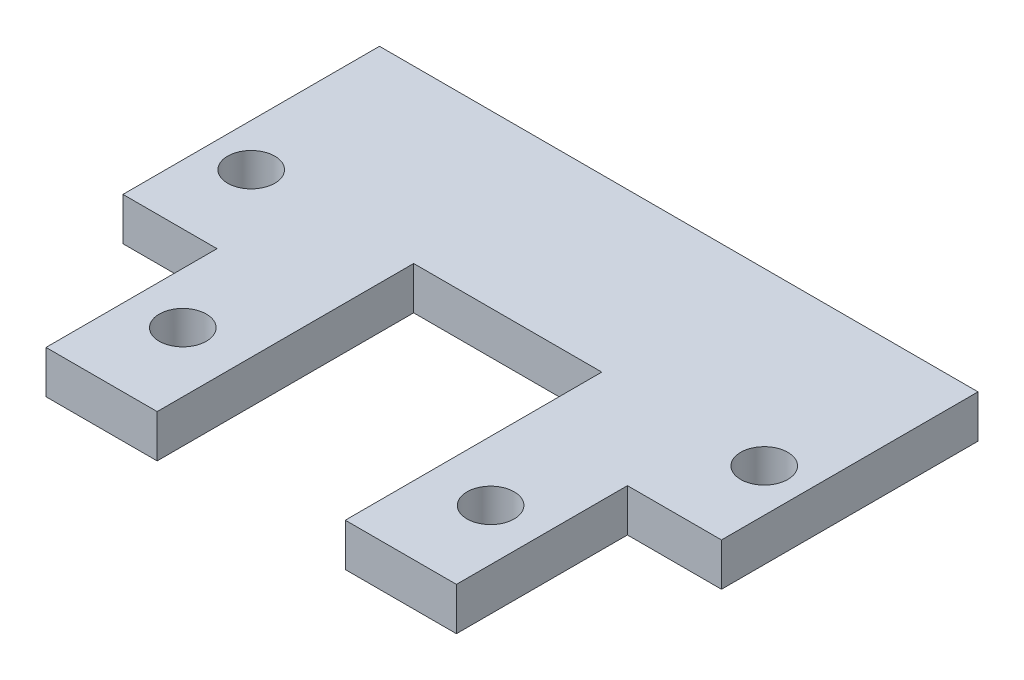
from build123d import *

# Parameters (mm, degrees)
SKETCH1_R           = 1.75
BOSS_EXTRUDE1_DEPTH = 3.175
SKETCH2_R           = 1.75
CUT_EXTRUDE1_DEPTH  = 12.192
SKETCH3_W           = 13.97
SKETCH3_H           = 19.05
CUT_EXTRUDE2_DEPTH  = 25.4


with BuildPart() as part:
    # Sketch1 → Boss-Extrude1 (new body)
    with BuildSketch(Plane(origin=(0, 0, 0), x_dir=(-1, 0, 0), z_dir=(0, 1, 0))):
        Polygon((22.225, -12.7), (22.225, 6.35), (15.24, 6.35), (15.24, 19.05), (-15.24, 19.05), (-15.24, 6.35), (-22.225, 6.35), (-22.225, -12.7), align=None)
        with Locations((19.05, 0)):
            Circle(SKETCH1_R, mode=Mode.SUBTRACT)
        with Locations((-19.05, 0)):
            Circle(SKETCH1_R, mode=Mode.SUBTRACT)
    extrude(amount=BOSS_EXTRUDE1_DEPTH)

    # Sketch2 → Cut-Extrude1 (cut)
    with BuildSketch(Plane(origin=(0, 3.175, 0), x_dir=(-1, 0, 0), z_dir=(0, 1, 0))):
        with Locations((-11.43, 12.7)):
            Circle(SKETCH2_R)
        with Locations((11.43, 12.7)):
            Circle(SKETCH2_R)
    extrude(amount=-CUT_EXTRUDE1_DEPTH, mode=Mode.SUBTRACT)

    # Sketch3 → Cut-Extrude2 (cut)
    with BuildSketch(Plane(origin=(0, 3.175, 0), x_dir=(-1, 0, 0), z_dir=(0, 1, 0))):
        with Locations((0, 9.525)):
            Rectangle(SKETCH3_W, SKETCH3_H)
    extrude(amount=-CUT_EXTRUDE2_DEPTH, mode=Mode.SUBTRACT)


solid = part.part
